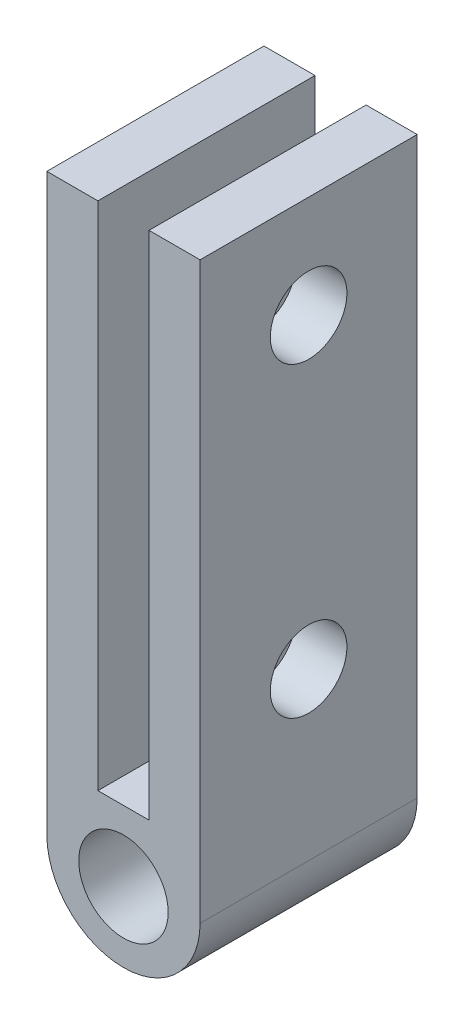
from build123d import *

# Parameters (mm, degrees)
CROQUIS1_R              = 1.75
SALIENTE_EXTRUIR1_DEPTH = 8.5
REDONDEO1_R             = 3
CORTAR_EXTRUIR1_START   = -6
CROQUIS2_R              = 1.5
CORTAR_EXTRUIR1_DEPTH   = 6


with BuildPart() as part:
    # Croquis1 → Saliente-Extruir1 (new body)
    with BuildSketch(Plane.XY):
        Polygon((1, 0), (-1, 0), (-1, 20), (-3, 20), (-3, -5.5), (3, -5.5), (3, 20), (1, 20), align=None)
        with Locations((0, -2.75)):
            Circle(CROQUIS1_R, mode=Mode.SUBTRACT)
    extrude(amount=SALIENTE_EXTRUIR1_DEPTH)

    # Redondeo1
    redondeo1_edges = [part.edges().sort_by_distance(p)[0] for p in [
        (-3, -5.5, 4.25),
        (3, -5.5, 4.25),
    ]]
    fillet(redondeo1_edges, radius=REDONDEO1_R - 0.0001)  # a hair under: the kernel refuses the full size

    # Croquis2 → Cortar-Extruir1 (cut)
    with BuildSketch(Plane(origin=(3, 0, 0), x_dir=(0, 0, -1), z_dir=(1, 0, 0)).offset(CORTAR_EXTRUIR1_START)):
        with Locations(Location((-4.25, 16, 0), (0, 0, 90))):
            Circle(CROQUIS2_R)
        with Locations(Location((-4.25, 4, 0), (0, 0, 90))):
            Circle(CROQUIS2_R)
    extrude(amount=CORTAR_EXTRUIR1_DEPTH, mode=Mode.SUBTRACT)


solid = part.part
